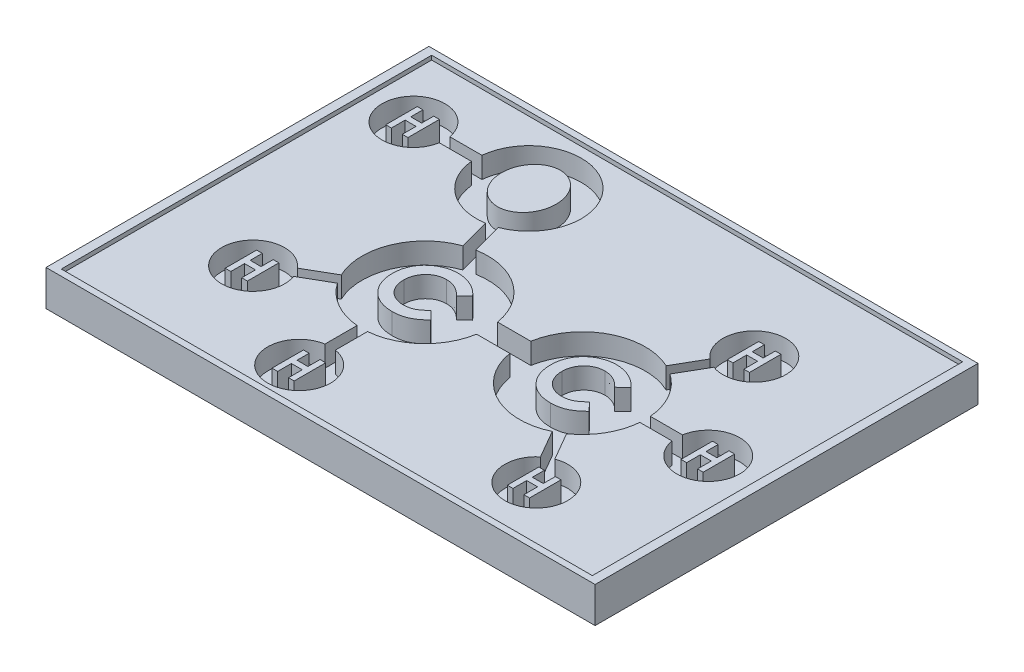
from build123d import *

# Parameters (mm, degrees)
SKETCH4_W           = 261.727970693
SKETCH4_H           = 182.520821668
BOSS_EXTRUDE1_DEPTH = 15
SKETCH2_RX          = 15
SKETCH2_RY          = 13
CUT_EXTRUDE1_DEPTH  = 10
SHELL1_OUTLINE_W    = 255.727970693
SHELL1_OUTLINE_H    = 176.520821668
SHELL1_DEPTH        = 12
SHELL1_2_DEPTH      = 2
SKETCH5_W           = 261.727970693
SKETCH5_H           = 182.520821668
SKETCH5_W_2         = 253.124197109
SKETCH5_H_2         = 176.520821668
BOSS_EXTRUDE2_DEPTH = 2


# Read off the part's stored shape, not the designer's step: Shell1
with BuildPart() as part:
    # Sketch4 → Boss-Extrude1 (new body)
    with BuildSketch(Plane(origin=(0, 0, 0), x_dir=(1, 0, 0), z_dir=(0, 1, 0))):
        with Locations((32.26902192, 9.183437568)):
            Rectangle(SKETCH4_W, SKETCH4_H)
    extrude(amount=BOSS_EXTRUDE1_DEPTH)

    # Sketch2 → Cut-Extrude1 (cut)
    with BuildSketch(Plane(origin=(0, 15, 0), x_dir=(1, 0, 0), z_dir=(0, 1, 0))):
        with BuildLine():
            Line((-14.094105264, 42.940658669), (-10.152378632, 28.22993461))
            ThreePointArc((-10.152378632, 28.22993461), (-27.716385975, 11.480502971), (-27.140393972, -12.782762419))
            Line((-27.140393972, -12.782762419), (-40.40283577, -20.439836762))
            ThreePointArc((-40.40283577, -20.439836762), (-64.951905284, -37.5), (-37.90283577, -24.769963781))
            Line((-37.90283577, -24.769963781), (-24.640393972, -17.112889438))
            ThreePointArc((-24.640393972, -17.112889438), (-15, -25.980762114), (-2.5, -29.895651858))
            Line((-2.5, -29.895651858), (-2.5, -45.209800542))
            ThreePointArc((-2.5, -45.209800542), (0, -75), (2.5, -45.209800542))
            Line((2.5, -45.209800542), (2.5, -29.895651858))
            ThreePointArc((2.5, -29.895651858), (20.303604828, -22.085371425), (29.580398915, -5))
            Line((29.580398915, -5), (45.419601085, -5))
            ThreePointArc((45.419601085, -5), (61.104338473, -26.587790257), (87.782762419, -27.140393972))
            Line((87.782762419, -27.140393972), (95.439836762, -40.40283577))
            ThreePointArc((95.439836762, -40.40283577), (112.5, -64.951905284), (99.769963781, -37.90283577))
            Line((99.769963781, -37.90283577), (92.112889438, -24.640393972))
            ThreePointArc((92.112889438, -24.640393972), (100.980762114, -15), (104.895651858, -2.5))
            Line((104.895651858, -2.5), (120.209800542, -2.5))
            ThreePointArc((120.209800542, -2.5), (150, 0), (120.209800542, 2.5))
            Line((120.209800542, 2.5), (104.895651858, 2.5))
            ThreePointArc((104.895651858, 2.5), (100.980762114, 15), (92.112889438, 24.640393972))
            Line((92.112889438, 24.640393972), (99.769963781, 37.90283577))
            ThreePointArc((99.769963781, 37.90283577), (112.5, 64.951905284), (95.439836762, 40.40283577))
            Line((95.439836762, 40.40283577), (87.782762419, 27.140393972))
            ThreePointArc((87.782762419, 27.140393972), (61.104338473, 26.587790257), (45.419601085, 5))
            Line((45.419601085, 5), (29.580398915, 5))
            ThreePointArc((29.580398915, 5), (17.247185238, 24.546580238), (-5.322749501, 29.524029836))
            Line((-5.322749501, 29.524029836), (-9.264476132, 44.234753895))
            ThreePointArc((-9.264476132, 44.234753895), (-2.898297432, 87.448641348), (-42.992019085, 70.11480784))
            Line((-42.992019085, 70.11480784), (-58.327133699, 70.11480784))
            ThreePointArc((-58.327133699, 70.11480784), (-88.117333157, 67.61480784), (-58.327133699, 65.11480784))
            Line((-58.327133699, 65.11480784), (-42.992019085, 65.11480784))
            ThreePointArc((-42.992019085, 65.11480784), (-33.336368882, 47.780974333), (-14.094105264, 42.940658669))
        make_face()
        with Locations(Location((-18.117333157, 67.61480784), (0, 0, 90))):
            Ellipse(SKETCH2_RX, SKETCH2_RY, mode=Mode.SUBTRACT)
        with BuildLine():
            Line((12.884615385, 9.795673077), (8.936298077, 6.021634615))
            add(Edge.make_bspline(
                [(8.936298077, 6.021634615), (8.601369637, 6.367951184), (7.947149463, 7.04441594), (6.892954564, 7.939995662), (5.796630252, 8.686340183), (4.679503328, 9.314906788), (3.521479919, 9.790462222), (2.335949928, 10.137007477), (1.115343397, 10.348283021), (0.289283845, 10.372456682), (-0.126201923, 10.384615385)],
                knots=[0, 0, 0, 0, 1.115251505, 2.178435587, 3.19620269, 4.182487026, 5.141301733, 6.088180966, 7.038406374, 8, 8, 8, 8], degree=3))
            add(Edge.make_bspline(
                [(-0.126201923, 10.384615385), (-0.473183031, 10.375009585), (-1.157912017, 10.356053597), (-2.163273603, 10.21708751), (-3.124953917, 9.980769631), (-4.046244945, 9.655079819), (-4.924435747, 9.233654488), (-5.761367561, 8.716819811), (-6.554976965, 8.10924354), (-7.294780839, 7.414069302), (-7.971527423, 6.654539207), (-8.569476121, 5.844122407), (-9.070354073, 4.984675523), (-9.48141646, 4.0849024), (-9.80161817, 3.140638442), (-10.03028242, 2.152519367), (-10.162535711, 1.1193684), (-10.182275401, 0.417040072), (-10.192307692, 0.060096154)],
                knots=[0, 0, 0, 0, 1.035432265, 2.043311493, 3.022114605, 3.98653278, 4.95457646, 5.923598177, 6.917315552, 7.932509744, 8.948865224, 9.949768934, 10.933144597, 11.912367597, 12.897413939, 13.903909035, 14.934704909, 16, 16, 16, 16], degree=3))
            add(Edge.make_bspline(
                [(-10.192307692, 0.060096154), (-10.1894165, -0.190432062), (-10.183717902, -0.684228323), (-10.121336662, -1.414690042), (-10.020888156, -2.123410598), (-9.875514282, -2.809316469), (-9.693722823, -3.473002067), (-9.480440048, -4.120192974), (-9.212879944, -4.74194647), (-8.915884191, -5.345483816), (-8.570481554, -5.914336742), (-8.198073792, -6.456785217), (-7.794258377, -6.970170213), (-7.356419771, -7.452392997), (-6.878395941, -7.895917507), (-6.372542034, -8.314081052), (-5.830324996, -8.696415582), (-5.263008048, -9.052516203), (-4.665690288, -9.361863843), (-4.054578333, -9.64207304), (-3.420406492, -9.86964457), (-2.77089619, -10.053087983), (-2.108368548, -10.20907921), (-1.426343429, -10.305127802), (-0.730733137, -10.377864276), (-0.260617338, -10.382355329), (-0.024038462, -10.384615385)],
                knots=[0, 0, 0, 0, 1.103660481, 2.175337485, 3.227646561, 4.255952547, 5.262355991, 6.258840057, 7.255597736, 8.242457506, 9.22035537, 10.185017736, 11.140346927, 12.096287581, 13.051739095, 14.01125915, 14.986044842, 15.97314143, 16.960198552, 17.947847494, 18.933482797, 19.925264591, 20.920966487, 21.929612487, 22.958107872, 24, 24, 24, 24], degree=3))
            add(Edge.make_bspline(
                [(-0.024038462, -10.384615385), (0.377239969, -10.373008283), (1.165647738, -10.350203346), (2.322749501, -10.171871972), (3.425352206, -9.878526953), (4.306326491, -9.53210353), (4.996546573, -9.190005903), (5.522000918, -8.873582444), (6.065361665, -8.519628064), (6.617604056, -8.114784142), (7.184939722, -7.663908966), (7.757353881, -7.157127528), (8.349500437, -6.611127416), (8.737409777, -6.221436409), (8.936298077, -6.021634615)],
                knots=[0, 0, 0, 0, 1.404581149, 2.759636711, 4.088442092, 5.392261763, 6.066678138, 6.783632037, 7.538459478, 8.336747902, 9.180226004, 10.074962426, 11.012997595, 12, 12, 12, 12], degree=3))
            Line((8.936298077, -6.021634615), (12.764423077, -10.042067308))
            add(Edge.make_bspline(
                [(12.764423077, -10.042067308), (12.495326495, -10.30187161), (11.970107514, -10.808954047), (11.177829262, -11.528963789), (10.386548124, -12.175972583), (9.615379804, -12.773464011), (8.851691759, -13.304031699), (8.095564978, -13.768205529), (7.355559147, -14.177725129), (6.616307807, -14.525684153), (5.873210955, -14.821137503), (5.10865162, -15.075503445), (4.320292472, -15.290687881), (3.503318574, -15.464313461), (2.665350159, -15.603537736), (1.798544958, -15.697513316), (0.908398943, -15.760689972), (0.30459911, -15.766366918), (0, -15.769230769)],
                knots=[0, 0, 0, 0, 1.244526981, 2.429050516, 3.560637417, 4.644440555, 5.67424972, 6.652764056, 7.595344123, 8.486817594, 9.369275933, 10.254498637, 11.166417451, 12.086725134, 13.032340136, 13.991389299, 14.986715468, 16, 16, 16, 16], degree=3))
            add(Edge.make_bspline(
                [(0, -15.769230769), (-0.559510834, -15.754967722), (-1.65431801, -15.727058904), (-3.258729381, -15.520273457), (-4.782877116, -15.173601297), (-6.230469181, -14.683311243), (-7.601045275, -14.056988677), (-8.894254763, -13.289146621), (-10.108013278, -12.381825109), (-11.232516042, -11.345658832), (-12.249682309, -10.201300165), (-13.148739495, -8.9725729), (-13.892439633, -7.653438293), (-14.509949883, -6.263384176), (-14.992834777, -4.796067192), (-15.33270388, -3.249900151), (-15.542298676, -1.626375973), (-15.565228644, -0.517471534), (-15.576923077, 0.048076923)],
                knots=[0, 0, 0, 0, 1.078019885, 2.10938526, 3.111377082, 4.085535484, 5.04941344, 6.010039228, 6.978205633, 7.964457913, 8.951525778, 9.924444315, 10.892603023, 11.863865945, 12.85144698, 13.863884204, 14.910567087, 16, 16, 16, 16], degree=3))
            add(Edge.make_bspline(
                [(-15.576923077, 0.048076923), (-15.571981576, 0.416922802), (-15.56218873, 1.147885185), (-15.45926501, 2.224651995), (-15.315783359, 3.274307031), (-15.088162767, 4.285951395), (-14.813788593, 5.273213802), (-14.472568259, 6.225363864), (-14.065046741, 7.145138155), (-13.604359417, 8.034076432), (-13.083188457, 8.886355199), (-12.50098328, 9.694652035), (-11.872732119, 10.465206845), (-11.183339121, 11.187796789), (-10.44282207, 11.868766346), (-9.647837616, 12.504425213), (-8.803167194, 13.103889454), (-7.906524595, 13.651700341), (-6.975329195, 14.147224407), (-6.021325819, 14.584297795), (-5.046858343, 14.949590498), (-4.056046903, 15.252587319), (-3.044705334, 15.478753022), (-2.020052334, 15.649953163), (-0.973369337, 15.745655137), (-0.270612382, 15.761322161), (0.084134615, 15.769230769)],
                knots=[0, 0, 0, 0, 1.071919942, 2.124283339, 3.142214191, 4.149696895, 5.136002878, 6.119640489, 7.086990633, 8.058538607, 9.028339693, 9.988281803, 10.952401235, 11.916291999, 12.888973767, 13.874849856, 14.873389453, 15.898127285, 16.927174885, 17.938320013, 18.946391617, 19.950418109, 20.947802303, 21.956882652, 22.968648068, 24, 24, 24, 24], degree=3))
            add(Edge.make_bspline(
                [(0.084134615, 15.769230769), (0.386770177, 15.764697357), (0.988894734, 15.755677669), (1.88555924, 15.68048875), (2.775052642, 15.562405315), (3.654190282, 15.384242557), (4.529260652, 15.172740849), (5.388764344, 14.895808537), (6.246260497, 14.587115286), (7.088300554, 14.218135537), (7.916059881, 13.815360811), (8.710146913, 13.358398258), (9.483894296, 12.875368842), (10.220156253, 12.337684766), (10.932724557, 11.764848832), (11.617873125, 11.154188438), (12.269589378, 10.495522083), (12.678570312, 10.030135421), (12.884615385, 9.795673077)],
                knots=[0, 0, 0, 0, 0.996412454, 1.982464992, 2.961075852, 3.949442424, 4.934965278, 5.923860011, 6.921385422, 7.934793307, 8.949617135, 9.951082467, 10.950285876, 11.951772932, 12.951063433, 13.960125323, 14.972308753, 16, 16, 16, 16], degree=3))
        make_face(mode=Mode.SUBTRACT)
        with BuildLine():
            Line((88.346153846, 9.795673077), (84.397836538, 6.021634615))
            add(Edge.make_bspline(
                [(84.397836538, 6.021634615), (84.062908098, 6.367951184), (83.408687925, 7.04441594), (82.354493025, 7.939995662), (81.258168713, 8.686340183), (80.14104179, 9.314906788), (78.983018381, 9.790462222), (77.79748839, 10.137007477), (76.576881859, 10.348283021), (75.750822307, 10.372456682), (75.335336538, 10.384615385)],
                knots=[0, 0, 0, 0, 1.115251505, 2.178435587, 3.19620269, 4.182487026, 5.141301733, 6.088180966, 7.038406374, 8, 8, 8, 8], degree=3))
            add(Edge.make_bspline(
                [(75.335336538, 10.384615385), (74.988355431, 10.375009585), (74.303626444, 10.356053597), (73.298264859, 10.21708751), (72.336584545, 9.980769631), (71.415293517, 9.655079819), (70.537102714, 9.233654488), (69.7001709, 8.716819811), (68.906561496, 8.10924354), (68.166757623, 7.414069302), (67.490011038, 6.654539207), (66.89206234, 5.844122407), (66.391184389, 4.984675523), (65.980122001, 4.0849024), (65.659920292, 3.140638442), (65.431256042, 2.152519367), (65.29900275, 1.1193684), (65.27926306, 0.417040072), (65.269230769, 0.060096154)],
                knots=[0, 0, 0, 0, 1.035432265, 2.043311493, 3.022114605, 3.98653278, 4.95457646, 5.923598177, 6.917315552, 7.932509744, 8.948865224, 9.949768934, 10.933144597, 11.912367597, 12.897413939, 13.903909035, 14.934704909, 16, 16, 16, 16], degree=3))
            add(Edge.make_bspline(
                [(65.269230769, 0.060096154), (65.272121961, -0.190432062), (65.27782056, -0.684228323), (65.3402018, -1.414690042), (65.440650305, -2.123410598), (65.58602418, -2.809316469), (65.767815639, -3.473002067), (65.981098414, -4.120192974), (66.248658518, -4.74194647), (66.54565427, -5.345483816), (66.891056908, -5.914336742), (67.263464669, -6.456785217), (67.667280085, -6.970170213), (68.105118691, -7.452392997), (68.583142521, -7.895917507), (69.088996427, -8.314081052), (69.631213465, -8.696415582), (70.198530414, -9.052516203), (70.795848173, -9.361863843), (71.406960129, -9.64207304), (72.041131969, -9.86964457), (72.690642271, -10.053087983), (73.353169914, -10.20907921), (74.035195033, -10.305127802), (74.730805325, -10.377864276), (75.200921124, -10.382355329), (75.4375, -10.384615385)],
                knots=[0, 0, 0, 0, 1.103660481, 2.175337485, 3.227646561, 4.255952547, 5.262355991, 6.258840057, 7.255597736, 8.242457506, 9.22035537, 10.185017736, 11.140346927, 12.096287581, 13.051739095, 14.01125915, 14.986044842, 15.97314143, 16.960198552, 17.947847494, 18.933482797, 19.925264591, 20.920966487, 21.929612487, 22.958107872, 24, 24, 24, 24], degree=3))
            add(Edge.make_bspline(
                [(75.4375, -10.384615385), (75.838778431, -10.373008283), (76.627186199, -10.350203346), (77.784287963, -10.171871972), (78.886890667, -9.878526953), (79.767864952, -9.53210353), (80.458085035, -9.190005903), (80.98353938, -8.873582444), (81.526900126, -8.519628064), (82.079142517, -8.114784142), (82.646478183, -7.663908966), (83.218892343, -7.157127528), (83.811038899, -6.611127416), (84.198948238, -6.221436409), (84.397836538, -6.021634615)],
                knots=[0, 0, 0, 0, 1.404581149, 2.759636711, 4.088442092, 5.392261763, 6.066678138, 6.783632037, 7.538459478, 8.336747902, 9.180226004, 10.074962426, 11.012997595, 12, 12, 12, 12], degree=3))
            Line((84.397836538, -6.021634615), (88.225961538, -10.042067308))
            add(Edge.make_bspline(
                [(88.225961538, -10.042067308), (87.956864956, -10.30187161), (87.431645976, -10.808954047), (86.639367724, -11.528963789), (85.848086586, -12.175972583), (85.076918265, -12.773464011), (84.313230221, -13.304031699), (83.55710344, -13.768205529), (82.817097609, -14.177725129), (82.077846269, -14.525684153), (81.334749417, -14.821137503), (80.570190082, -15.075503445), (79.781830934, -15.290687881), (78.964857035, -15.464313461), (78.126888621, -15.603537736), (77.260083419, -15.697513316), (76.369937404, -15.760689972), (75.766137571, -15.766366918), (75.461538462, -15.769230769)],
                knots=[0, 0, 0, 0, 1.244526981, 2.429050516, 3.560637417, 4.644440555, 5.67424972, 6.652764056, 7.595344123, 8.486817594, 9.369275933, 10.254498637, 11.166417451, 12.086725134, 13.032340136, 13.991389299, 14.986715468, 16, 16, 16, 16], degree=3))
            add(Edge.make_bspline(
                [(75.461538462, -15.769230769), (74.902027628, -15.754967722), (73.807220452, -15.727058904), (72.20280908, -15.520273457), (70.678661345, -15.173601297), (69.23106928, -14.683311243), (67.860493187, -14.056988677), (66.567283699, -13.289146621), (65.353525183, -12.381825109), (64.22902242, -11.345658832), (63.211856153, -10.201300165), (62.312798966, -8.9725729), (61.569098828, -7.653438293), (60.951588578, -6.263384176), (60.468703684, -4.796067192), (60.128834581, -3.249900151), (59.919239786, -1.626375973), (59.896309817, -0.517471534), (59.884615385, 0.048076923)],
                knots=[0, 0, 0, 0, 1.078019885, 2.10938526, 3.111377082, 4.085535484, 5.04941344, 6.010039228, 6.978205633, 7.964457913, 8.951525778, 9.924444315, 10.892603023, 11.863865945, 12.85144698, 13.863884204, 14.910567087, 16, 16, 16, 16], degree=3))
            add(Edge.make_bspline(
                [(59.884615385, 0.048076923), (59.889556885, 0.416922802), (59.899349731, 1.147885185), (60.002273452, 2.224651995), (60.145755102, 3.274307031), (60.373375695, 4.285951395), (60.647749869, 5.273213802), (60.988970203, 6.225363864), (61.396491721, 7.145138155), (61.857179045, 8.034076432), (62.378350005, 8.886355199), (62.960555181, 9.694652035), (63.588806343, 10.465206845), (64.278199341, 11.187796789), (65.018716392, 11.868766346), (65.813700845, 12.504425213), (66.658371268, 13.103889454), (67.555013867, 13.651700341), (68.486209267, 14.147224407), (69.440212642, 14.584297795), (70.414680119, 14.949590498), (71.405491558, 15.252587319), (72.416833128, 15.478753022), (73.441486127, 15.649953163), (74.488169124, 15.745655137), (75.19092608, 15.761322161), (75.545673077, 15.769230769)],
                knots=[0, 0, 0, 0, 1.071919942, 2.124283339, 3.142214191, 4.149696895, 5.136002878, 6.119640489, 7.086990633, 8.058538607, 9.028339693, 9.988281803, 10.952401235, 11.916291999, 12.888973767, 13.874849856, 14.873389453, 15.898127285, 16.927174885, 17.938320013, 18.946391617, 19.950418109, 20.947802303, 21.956882652, 22.968648068, 24, 24, 24, 24], degree=3))
            add(Edge.make_bspline(
                [(75.545673077, 15.769230769), (75.848308639, 15.764697357), (76.450433196, 15.755677669), (77.347097701, 15.68048875), (78.236591104, 15.562405315), (79.115728744, 15.384242557), (79.990799113, 15.172740849), (80.850302806, 14.895808537), (81.707798958, 14.587115286), (82.549839016, 14.218135537), (83.377598343, 13.815360811), (84.171685374, 13.358398258), (84.945432758, 12.875368842), (85.681694715, 12.337684766), (86.394263019, 11.764848832), (87.079411587, 11.154188438), (87.731127839, 10.495522083), (88.140108773, 10.030135421), (88.346153846, 9.795673077)],
                knots=[0, 0, 0, 0, 0.996412454, 1.982464992, 2.961075852, 3.949442424, 4.934965278, 5.923860011, 6.921385422, 7.934793307, 8.949617135, 9.951082467, 10.950285876, 11.951772932, 12.951063433, 13.960125323, 14.972308753, 16, 16, 16, 16], degree=3))
        make_face(mode=Mode.SUBTRACT)
        Polygon((-78.52734675, 74.803575107), (-75.835039057, 74.803575107), (-75.835039057, 69.034344338), (-70.642731365, 69.034344338), (-70.642731365, 74.803575107), (-67.950423673, 74.803575107), (-67.950423673, 59.803575107), (-70.642731365, 59.803575107), (-70.642731365, 66.342036646), (-75.835039057, 66.342036646), (-75.835039057, 59.803575107), (-78.52734675, 59.803575107), align=None, mode=Mode.SUBTRACT)
        Polygon((-57.567505213, -22.699814423), (-54.87519752, -22.699814423), (-54.87519752, -28.469045193), (-49.682889828, -28.469045193), (-49.682889828, -22.699814423), (-46.990582136, -22.699814423), (-46.990582136, -37.699814423), (-49.682889828, -37.699814423), (-49.682889828, -31.161352885), (-54.87519752, -31.161352885), (-54.87519752, -37.699814423), (-57.567505213, -37.699814423), align=None, mode=Mode.SUBTRACT)
        Polygon((-5.161140218, -52.783368386), (-2.468832526, -52.783368386), (-2.468832526, -58.552599155), (2.723475167, -58.552599155), (2.723475167, -52.783368386), (5.415782859, -52.783368386), (5.415782859, -67.783368386), (2.723475167, -67.783368386), (2.723475167, -61.244906847), (-2.468832526, -61.244906847), (-2.468832526, -67.783368386), (-5.161140218, -67.783368386), align=None, mode=Mode.SUBTRACT)
        Polygon((99.230769231, -45), (101.923076923, -45), (101.923076923, -50.769230769), (107.115384615, -50.769230769), (107.115384615, -45), (109.807692308, -45), (109.807692308, -60), (107.115384615, -60), (107.115384615, -53.461538462), (101.923076923, -53.461538462), (101.923076923, -60), (99.230769231, -60), align=None, mode=Mode.SUBTRACT)
        Polygon((129.983609875, 7.028699134), (132.675917567, 7.028699134), (132.675917567, 1.259468365), (137.86822526, 1.259468365), (137.86822526, 7.028699134), (140.560532952, 7.028699134), (140.560532952, -7.971300866), (137.86822526, -7.971300866), (137.86822526, -1.432839327), (132.675917567, -1.432839327), (132.675917567, -7.971300866), (129.983609875, -7.971300866), align=None, mode=Mode.SUBTRACT)
        Polygon((99.836874992, 59.234753895), (102.529182685, 59.234753895), (102.529182685, 53.465523125), (107.721490377, 53.465523125), (107.721490377, 59.234753895), (110.413798069, 59.234753895), (110.413798069, 44.234753895), (107.721490377, 44.234753895), (107.721490377, 50.773215433), (102.529182685, 50.773215433), (102.529182685, 44.234753895), (99.836874992, 44.234753895), align=None, mode=Mode.SUBTRACT)
    extrude(amount=-CUT_EXTRUDE1_DEPTH, mode=Mode.SUBTRACT)

    # Shell1 outline → Shell1 (cut)
    # profile 1 of 2: a face of its own
    with BuildSketch(Plane(origin=(0, 0, 0), x_dir=(1, 0, 0), z_dir=(0, 1, 0))):
        with Locations((32.26902192, 9.183437568)):
            Rectangle(SHELL1_OUTLINE_W, SHELL1_OUTLINE_H)
        with BuildLine():
            ThreePointArc((32.015621187, -8), (22.41404031, -24.220049483), (5.5, -32.538438807))
            Line((5.5, -32.538438807), (5.5, -42.860863499))
            ThreePointArc((5.5, -42.860863499), (0, -78), (-5.5, -42.860863499))
            Line((-5.5, -42.860863499), (-5.5, -32.538438807))
            ThreePointArc((-5.5, -32.538438807), (-16.5, -28.578838325), (-25.429114606, -21.032359124))
            Line((-25.429114606, -21.032359124), (-34.368596618, -26.19357147))
            ThreePointArc((-34.368596618, -26.19357147), (-67.549981494, -39.000000001), (-39.868596618, -16.667292029))
            Line((-39.868596618, -16.667292029), (-30.929114606, -11.506079683))
            ThreePointArc((-30.929114606, -11.506079683), (-30.488024573, 12.628553268), (-13.734159706, 30.006213643))
            Line((-13.734159706, 30.006213643), (-16.324175702, 39.672284934))
            ThreePointArc((-16.324175702, 39.672284934), (-35.162653169, 45.400914312), (-45.571840984, 62.11480784))
            Line((-45.571840984, 62.11480784), (-55.978196656, 62.11480784))
            ThreePointArc((-55.978196656, 62.11480784), (-91.117333157, 67.61480784), (-55.978196656, 73.11480784))
            Line((-55.978196656, 73.11480784), (-45.571840984, 73.11480784))
            ThreePointArc((-45.571840984, 73.11480784), (-1.072013146, 89.828701369), (-5.698991613, 42.519294431))
            Line((-5.698991613, 42.519294431), (-3.108975617, 32.853223139))
            ThreePointArc((-3.108975617, 32.853223139), (19.060934254, 26.938462936), (32.015621187, 8))
            Line((32.015621187, 8), (42.984378813, 8))
            ThreePointArc((42.984378813, 8), (59.618309672, 29.19595182), (86.506079683, 30.929114606))
            Line((86.506079683, 30.929114606), (91.667292029, 39.868596618))
            ThreePointArc((91.667292029, 39.868596618), (114.000000001, 67.549981494), (101.19357147, 34.368596618))
            Line((101.19357147, 34.368596618), (96.032359124, 25.429114606))
            ThreePointArc((96.032359124, 25.429114606), (103.578838325, 16.5), (107.538438807, 5.5))
            Line((107.538438807, 5.5), (117.860863499, 5.5))
            ThreePointArc((117.860863499, 5.5), (153, 0), (117.860863499, -5.5))
            Line((117.860863499, -5.5), (107.538438807, -5.5))
            ThreePointArc((107.538438807, -5.5), (103.578838325, -16.5), (96.032359124, -25.429114606))
            Line((96.032359124, -25.429114606), (101.19357147, -34.368596618))
            ThreePointArc((101.19357147, -34.368596618), (114.000000001, -67.549981494), (91.667292029, -39.868596618))
            Line((91.667292029, -39.868596618), (86.506079683, -30.929114606))
            ThreePointArc((86.506079683, -30.929114606), (59.618309672, -29.19595182), (42.984378813, -8))
            Line((42.984378813, -8), (32.015621187, -8))
        make_face(mode=Mode.SUBTRACT)
    # profile 2 of 2: a face of its own
    with BuildSketch(Plane(origin=(0, 0, 0), x_dir=(1, 0, 0), z_dir=(0, 1, 0))):
        with BuildLine():
            add(Edge.make_bspline(
                [(-18.117333157, 55.61480784), (-16.755244035, 55.61480784), (-15.393161953, 55.861670902), (-14.054882485, 56.355488828), (-12.764688101, 57.096543575), (-11.552155029, 58.087372941), (-10.467291438, 59.318852156), (-9.551521972, 60.756336331), (-8.840506194, 62.358863316), (-8.358391227, 64.07336715), (-8.117333157, 65.844091981), (-8.117333157, 69.3855237), (-8.358391227, 71.15624853), (-8.840506194, 72.870752364), (-9.551521972, 74.473279349), (-10.467291438, 75.910763525), (-11.552155029, 77.142242739), (-12.764688101, 78.133072106), (-14.054882485, 78.874126853), (-15.393161953, 79.367944779), (-16.755244035, 79.61480784), (-19.47942228, 79.61480784), (-20.841504362, 79.367944779), (-22.179783829, 78.874126853), (-23.469978213, 78.133072106), (-24.682511285, 77.142242739), (-25.767374876, 75.910763525), (-26.683144343, 74.473279349), (-27.394160121, 72.870752364), (-27.876275087, 71.15624853), (-28.117333157, 69.3855237), (-28.117333157, 65.844091981), (-27.876275087, 64.07336715), (-27.394160121, 62.358863316), (-26.683144343, 60.756336331), (-25.767374876, 59.318852156), (-24.682511285, 58.087372941), (-23.469978213, 57.096543575), (-22.179783829, 56.355488828), (-20.841504362, 55.861670902), (-19.47942228, 55.61480784), (-18.117333157, 55.61480784)],
                knots=[3.141592654, 3.141592654, 3.141592654, 3.141592654, 3.141592654, 3.141592654, 3.141592654, 3.141592654, 3.141592654, 3.141592654, 3.141592654, 3.141592654, 4.71238898, 4.71238898, 4.71238898, 4.71238898, 4.71238898, 4.71238898, 4.71238898, 4.71238898, 4.71238898, 4.71238898, 6.283185307, 6.283185307, 6.283185307, 6.283185307, 6.283185307, 6.283185307, 6.283185307, 6.283185307, 6.283185307, 6.283185307, 7.853981634, 7.853981634, 7.853981634, 7.853981634, 7.853981634, 7.853981634, 7.853981634, 7.853981634, 7.853981634, 7.853981634, 9.424777961, 9.424777961, 9.424777961, 9.424777961, 9.424777961, 9.424777961, 9.424777961, 9.424777961, 9.424777961, 9.424777961, 9.424777961, 9.424777961], degree=11))
        make_face()
    extrude(amount=SHELL1_DEPTH, mode=Mode.SUBTRACT)

    # Shell1 2 outline → Shell1 2 (cut)
    with BuildSketch(Plane(origin=(0, 0, 0), x_dir=(1, 0, 0), z_dir=(0, 1, 0))):
        with BuildLine():
            Line((5.5, -42.860863499), (5.5, -32.538438807))
            ThreePointArc((5.5, -32.538438807), (22.41404031, -24.220049483), (32.015621187, -8))
            Line((32.015621187, -8), (42.984378813, -8))
            ThreePointArc((42.984378813, -8), (59.618309672, -29.19595182), (86.506079683, -30.929114606))
            Line((86.506079683, -30.929114606), (91.667292029, -39.868596618))
            ThreePointArc((91.667292029, -39.868596618), (114.000000001, -67.549981494), (101.19357147, -34.368596618))
            Line((101.19357147, -34.368596618), (96.032359124, -25.429114606))
            ThreePointArc((96.032359124, -25.429114606), (103.578838325, -16.5), (107.538438807, -5.5))
            Line((107.538438807, -5.5), (117.860863499, -5.5))
            ThreePointArc((117.860863499, -5.5), (153, 0), (117.860863499, 5.5))
            Line((117.860863499, 5.5), (107.538438807, 5.5))
            ThreePointArc((107.538438807, 5.5), (103.578838325, 16.5), (96.032359124, 25.429114606))
            Line((96.032359124, 25.429114606), (101.19357147, 34.368596618))
            ThreePointArc((101.19357147, 34.368596618), (114.000000001, 67.549981494), (91.667292029, 39.868596618))
            Line((91.667292029, 39.868596618), (86.506079683, 30.929114606))
            ThreePointArc((86.506079683, 30.929114606), (59.618309672, 29.19595182), (42.984378813, 8))
            Line((42.984378813, 8), (32.015621187, 8))
            ThreePointArc((32.015621187, 8), (19.060934254, 26.938462936), (-3.108975617, 32.853223139))
            Line((-3.108975617, 32.853223139), (-5.698991613, 42.519294431))
            ThreePointArc((-5.698991613, 42.519294431), (-1.072013146, 89.828701369), (-45.571840984, 73.11480784))
            Line((-45.571840984, 73.11480784), (-55.978196656, 73.11480784))
            ThreePointArc((-55.978196656, 73.11480784), (-91.117333157, 67.61480784), (-55.978196656, 62.11480784))
            Line((-55.978196656, 62.11480784), (-45.571840984, 62.11480784))
            ThreePointArc((-45.571840984, 62.11480784), (-35.162653169, 45.400914312), (-16.324175702, 39.672284934))
            Line((-16.324175702, 39.672284934), (-13.734159706, 30.006213643))
            ThreePointArc((-13.734159706, 30.006213643), (-30.488024573, 12.628553268), (-30.929114606, -11.506079683))
            Line((-30.929114606, -11.506079683), (-39.868596618, -16.667292029))
            ThreePointArc((-39.868596618, -16.667292029), (-67.549981494, -39.000000001), (-34.368596618, -26.19357147))
            Line((-34.368596618, -26.19357147), (-25.429114606, -21.032359124))
            ThreePointArc((-25.429114606, -21.032359124), (-16.5, -28.578838325), (-5.5, -32.538438807))
            Line((-5.5, -32.538438807), (-5.5, -42.860863499))
            ThreePointArc((-5.5, -42.860863499), (0, -78), (5.5, -42.860863499))
        make_face()
        with BuildLine():
            add(Edge.make_bspline(
                [(-18.117333157, 55.61480784), (-16.755244035, 55.61480784), (-15.393161953, 55.861670902), (-14.054882485, 56.355488828), (-12.764688101, 57.096543575), (-11.552155029, 58.087372941), (-10.467291438, 59.318852156), (-9.551521972, 60.756336331), (-8.840506194, 62.358863316), (-8.358391227, 64.07336715), (-8.117333157, 65.844091981), (-8.117333157, 69.3855237), (-8.358391227, 71.15624853), (-8.840506194, 72.870752364), (-9.551521972, 74.473279349), (-10.467291438, 75.910763525), (-11.552155029, 77.142242739), (-12.764688101, 78.133072106), (-14.054882485, 78.874126853), (-15.393161953, 79.367944779), (-16.755244035, 79.61480784), (-19.47942228, 79.61480784), (-20.841504362, 79.367944779), (-22.179783829, 78.874126853), (-23.469978213, 78.133072106), (-24.682511285, 77.142242739), (-25.767374876, 75.910763525), (-26.683144343, 74.473279349), (-27.394160121, 72.870752364), (-27.876275087, 71.15624853), (-28.117333157, 69.3855237), (-28.117333157, 65.844091981), (-27.876275087, 64.07336715), (-27.394160121, 62.358863316), (-26.683144343, 60.756336331), (-25.767374876, 59.318852156), (-24.682511285, 58.087372941), (-23.469978213, 57.096543575), (-22.179783829, 56.355488828), (-20.841504362, 55.861670902), (-19.47942228, 55.61480784), (-18.117333157, 55.61480784)],
                knots=[3.141592654, 3.141592654, 3.141592654, 3.141592654, 3.141592654, 3.141592654, 3.141592654, 3.141592654, 3.141592654, 3.141592654, 3.141592654, 3.141592654, 4.71238898, 4.71238898, 4.71238898, 4.71238898, 4.71238898, 4.71238898, 4.71238898, 4.71238898, 4.71238898, 4.71238898, 6.283185307, 6.283185307, 6.283185307, 6.283185307, 6.283185307, 6.283185307, 6.283185307, 6.283185307, 6.283185307, 6.283185307, 7.853981634, 7.853981634, 7.853981634, 7.853981634, 7.853981634, 7.853981634, 7.853981634, 7.853981634, 7.853981634, 7.853981634, 9.424777961, 9.424777961, 9.424777961, 9.424777961, 9.424777961, 9.424777961, 9.424777961, 9.424777961, 9.424777961, 9.424777961, 9.424777961, 9.424777961], degree=11))
        make_face(mode=Mode.SUBTRACT)
    extrude(amount=SHELL1_2_DEPTH, mode=Mode.SUBTRACT)

    # Sketch5 → Boss-Extrude2 (add)
    with BuildSketch(Plane(origin=(0, 15, 0), x_dir=(1, 0, 0), z_dir=(0, 1, 0))):
        with Locations((32.26902192, 9.183437568)):
            Rectangle(SKETCH5_W, SKETCH5_H)
        with Locations((32.26902192, 9.183437568)):
            Rectangle(SKETCH5_W_2, SKETCH5_H_2, mode=Mode.SUBTRACT)
    extrude(amount=BOSS_EXTRUDE2_DEPTH)


solid = part.part
